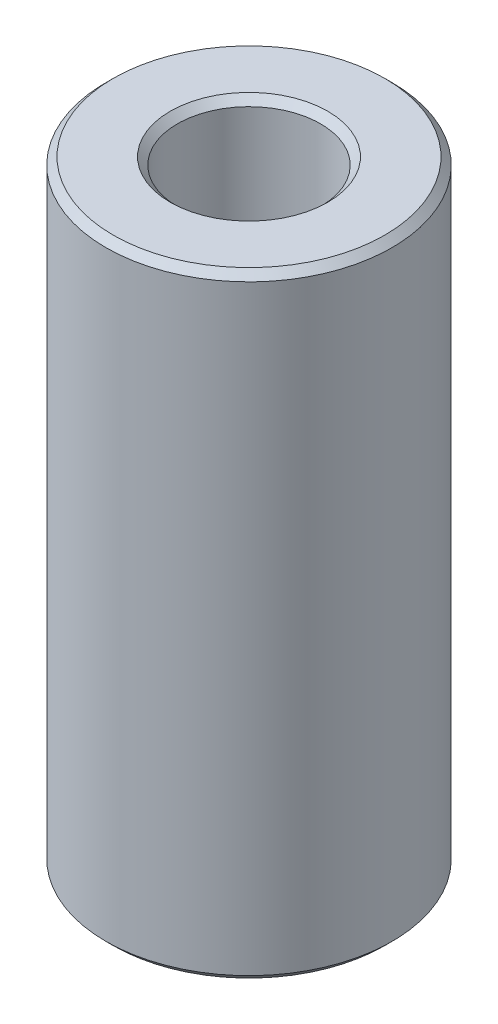
from build123d import *

# Parameters (mm, degrees)
SKETCH1_R           = 12.5
BOSS_EXTRUDE1_DEPTH = 53.775237574
SKETCH2_R           = 6.257288582
CUT_EXTRUDE1_DEPTH  = 57.60632629
CHAMFER1_SIZE       = 0.632380506


with BuildPart() as part:
    # Sketch1 → Boss-Extrude1 (new body)
    with BuildSketch(Plane(origin=(0, 0, 0), x_dir=(1, 0, 0), z_dir=(0, 1, 0))):
        Circle(SKETCH1_R)
    extrude(amount=BOSS_EXTRUDE1_DEPTH)

    # Sketch2 → Cut-Extrude1 (cut, through all)
    with BuildSketch(Plane(origin=(0, 0, 0), x_dir=(1, 0, 0), z_dir=(0, 1, 0))):
        Circle(SKETCH2_R)
    extrude(amount=CUT_EXTRUDE1_DEPTH, mode=Mode.SUBTRACT)

    # Chamfer1
    chamfer1_edges = [part.edges().sort_by_distance(p)[0] for p in [
        (-6.257288582, 53.775237574, 0),
        (-6.257288582, 0, 0),
        (-12.5, 0, 0),
        (-12.5, 53.775237574, 0),
    ]]
    chamfer(chamfer1_edges, length=CHAMFER1_SIZE)


solid = part.part
